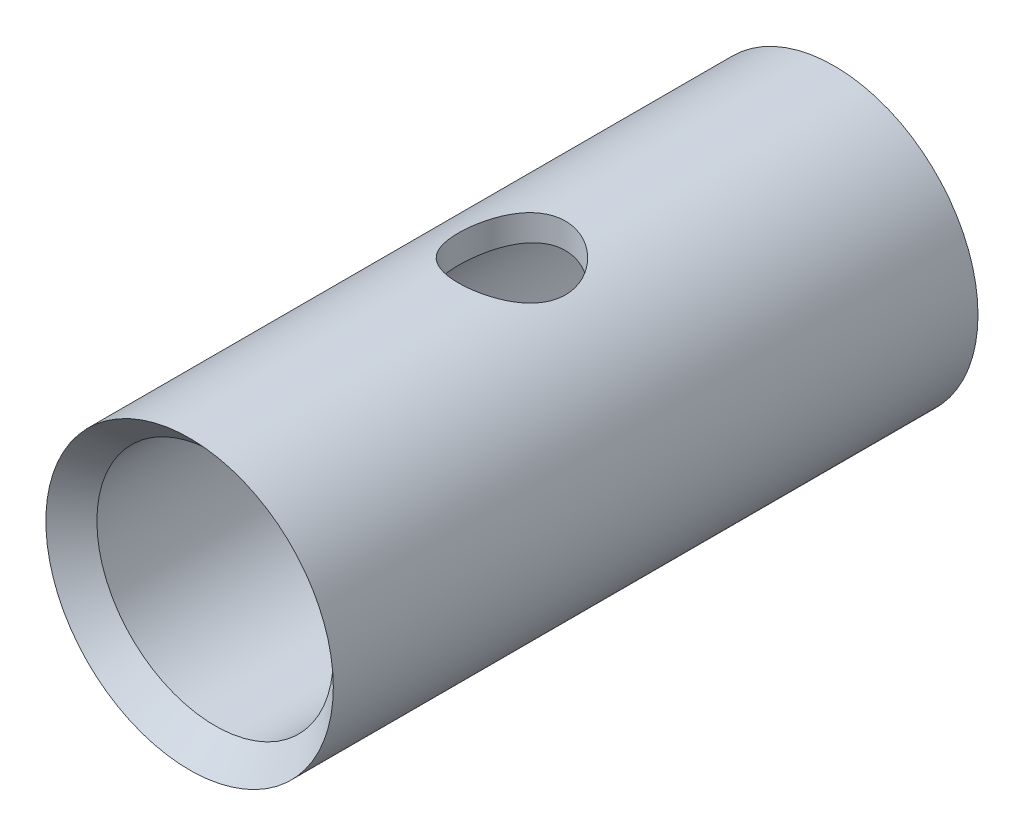
from build123d import *

# Parameters (mm, degrees)
CROQUIS1_R              = 16.9
CROQUIS1_R_2            = 13.9
SALIENTE_EXTRUIR1_DEPTH = 37.9
CROQUIS2_R              = 6.3
CORTAR_EXTRUIR1_DEPTH   = 20.8
CHAFL_N1_SIZE           = 3


with BuildPart() as part:
    # Croquis1 → Saliente-Extruir1 (new, symmetric)
    with BuildSketch(Plane.XY):
        Circle(CROQUIS1_R)
        Circle(CROQUIS1_R_2, mode=Mode.SUBTRACT)
    extrude(amount=SALIENTE_EXTRUIR1_DEPTH, both=True)

    # Croquis2 → Cortar-Extruir1 (cut)
    with BuildSketch(Plane(origin=(0, 16.9, 0), x_dir=(1, 0, 0), z_dir=(0, 1, 0))):
        with Locations(Location((0, 0, 0), (0, 0, 270))):
            Circle(CROQUIS2_R)
    extrude(amount=-CORTAR_EXTRUIR1_DEPTH, mode=Mode.SUBTRACT)

    # Chaflán1
    chafl_n1_edges = [part.edges().sort_by_distance(p)[0] for p in [
        (-13.9, 0, -37.9),
        (-13.9, 0, 37.9),
    ]]
    chamfer(chafl_n1_edges, length=CHAFL_N1_SIZE - 0.0001)  # a hair under: the kernel refuses the full size


solid = part.part
